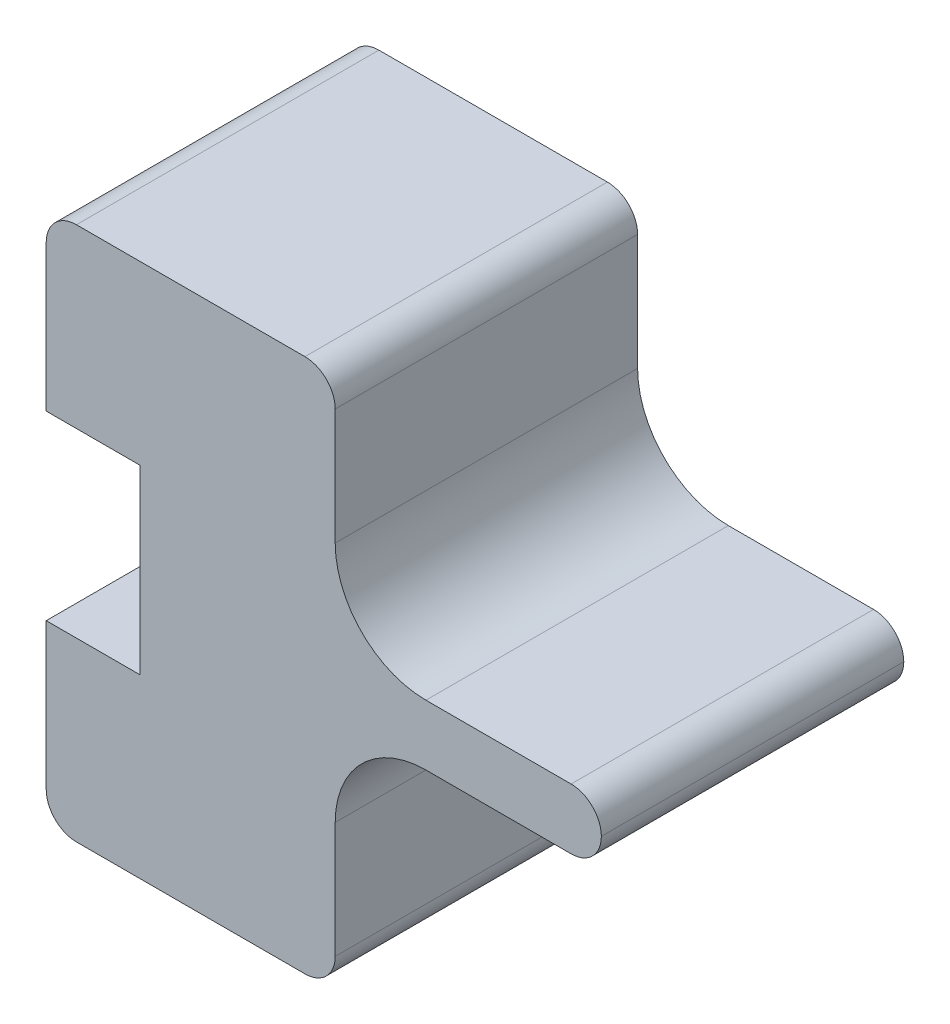
from build123d import *

# Parameters (mm, degrees)
BOSS_EXTRU_1_DEPTH = 100
ESQUISSE2_W        = 20
ESQUISSE2_H        = 60
BOSS_EXTRU_2_DEPTH = 40
CONG_1_R           = 10
CONG_2_R           = 10
CONG_3_R           = 10


with BuildPart() as part:
    # Esquisse1 → Boss.-Extru.1 (new body)
    with BuildSketch(Plane.XY):
        with BuildLine():
            Line((90, -10), (90, 10))
            Line((90, 10), (31.994888516, 10))
            ThreePointArc((31.994888516, 10), (10.78168508, 18.786796564), (1.994888516, 40))
            Line((1.994888516, 40), (1.994888516, 88.375065612))
            Line((1.994888516, 88.375065612), (-83.555876775, 88.375065612))
            ThreePointArc((-83.555876775, 88.375065612), (-90.626944587, 85.446133424), (-93.555876775, 78.375065612))
            Line((-93.555876775, 78.375065612), (-93.555876775, 30))
            Line((-93.555876775, 30), (-22.555876775, 30))
            Line((-22.555876775, 30), (-22.555876775, -30))
            Line((-22.555876775, -30), (-93.555876775, -30))
            Line((-93.555876775, -30), (-93.555876775, -78.375065612))
            ThreePointArc((-93.555876775, -78.375065612), (-90.626944587, -85.446133424), (-83.555876775, -88.375065612))
            Line((-83.555876775, -88.375065612), (1.994888516, -88.375065612))
            Line((1.994888516, -88.375065612), (1.994888516, -40))
            ThreePointArc((1.994888516, -40), (10.78168508, -18.786796564), (31.994888516, -10))
            Line((31.994888516, -10), (90, -10))
        make_face()
    extrude(amount=BOSS_EXTRU_1_DEPTH)

    # Esquisse2 → Boss.-Extru.2 (add)
    with BuildSketch(Plane.ZY.offset(22.555876775)):
        with Locations((90, 0)):
            Rectangle(ESQUISSE2_W, ESQUISSE2_H)
    extrude(amount=BOSS_EXTRU_2_DEPTH)

    # Congé1
    cong_1_edges = [part.edges().sort_by_distance(p)[0] for p in [
        (1.994888516, -88.375065612, 50),
    ]]
    fillet(cong_1_edges, radius=CONG_1_R)

    # Congé2
    cong_2_edges = [part.edges().sort_by_distance(p)[0] for p in [
        (1.994888516, 88.375065612, 50),
    ]]
    fillet(cong_2_edges, radius=CONG_2_R)

    # Congé3
    cong_3_edges = [part.edges().sort_by_distance(p)[0] for p in [
        (90, -10, 50),
        (90, 10, 50),
    ]]
    fillet(cong_3_edges, radius=CONG_3_R - 0.0001)  # a hair under: the kernel refuses the full size


solid = part.part
